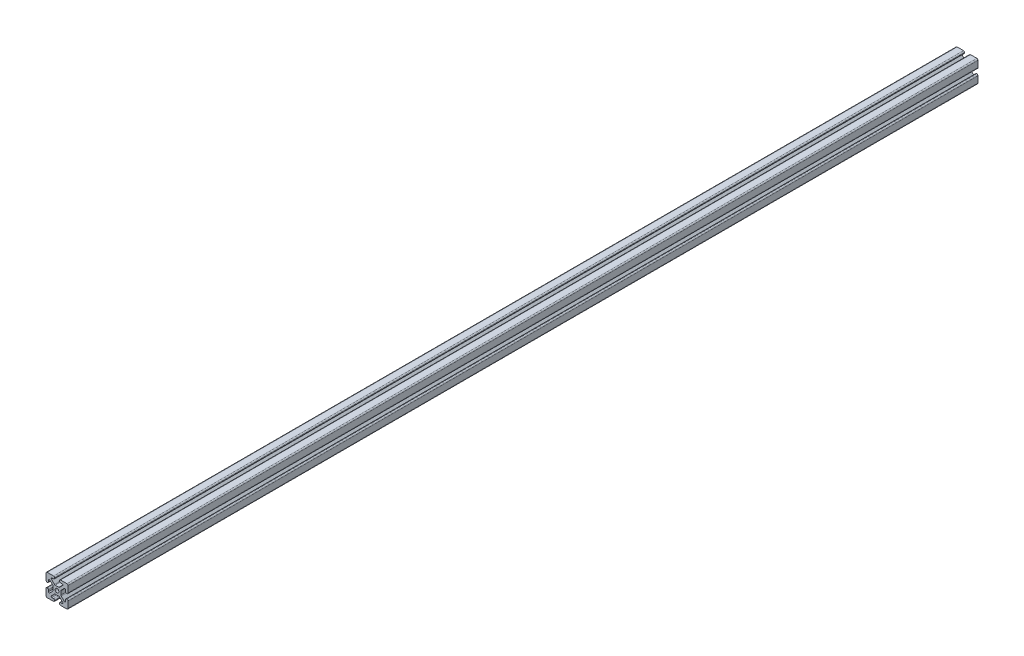
from build123d import *

# Parameters (mm, degrees)
SKETCH1_R           = 3.3274
BOSS_EXTRUDE1_DEPTH = 1574.8
FILLET2_R           = 2.032
FILLET3_R           = 2.032
FILLET4_R           = 1.27


with BuildPart() as part:
    # Sketch1 → Boss-Extrude1 (new body)
    with BuildSketch(Plane.XY):
        Polygon((6.7437, 3.870018041), (14.7447, 11.871018041), (14.7447, 4.064), (19.05, 4.064), (19.05, 19.05), (4.064, 19.05), (4.064, 14.7447), (11.871018041, 14.7447), (3.870018041, 6.7437), (-3.870018041, 6.7437), (-11.871018041, 14.7447), (-4.064, 14.7447), (-4.064, 19.05), (-19.05, 19.05), (-19.05, 4.064), (-14.7447, 4.064), (-14.7447, 11.871018041), (-6.7437, 3.870018041), (-6.7437, -3.870018041), (-14.7447, -11.871018041), (-14.7447, -4.064), (-19.05, -4.064), (-19.05, -19.05), (-4.064, -19.05), (-4.064, -14.7447), (-11.871018041, -14.7447), (-3.870018041, -6.7437), (3.870018041, -6.7437), (11.871018041, -14.7447), (4.064, -14.7447), (4.064, -19.05), (19.05, -19.05), (19.05, -4.064), (14.7447, -4.064), (14.7447, -11.871018041), (6.7437, -3.870018041), align=None)
        Circle(SKETCH1_R, mode=Mode.SUBTRACT)
    extrude(amount=BOSS_EXTRUDE1_DEPTH)

    # Fillet2
    fillet2_edges = [part.edges().sort_by_distance(p)[0] for p in [
        (-6.7437, -3.870018041, 787.4),
        (-6.7437, 3.870018041, 787.4),
        (-3.870018041, 6.7437, 787.4),
        (3.870018041, 6.7437, 787.4),
        (6.7437, 3.870018041, 787.4),
        (6.7437, -3.870018041, 787.4),
        (-3.870018041, -6.7437, 787.4),
        (3.870018041, -6.7437, 787.4),
    ]]
    fillet(fillet2_edges, radius=FILLET2_R)

    # Fillet3
    fillet3_edges = [part.edges().sort_by_distance(p)[0] for p in [
        (-19.05, -19.05, 787.4),
        (19.05, -19.05, 787.4),
        (19.05, 19.05, 787.4),
        (4.064, 14.7447, 787.4),
        (4.064, 19.05, 787.4),
        (-19.05, 19.05, 787.4),
        (-14.7447, -4.064, 787.4),
        (-19.05, -4.064, 787.4),
        (-19.05, 4.064, 787.4),
        (-14.7447, 4.064, 787.4),
        (-4.064, 14.7447, 787.4),
        (-4.064, 19.05, 787.4),
        (19.05, 4.064, 787.4),
        (14.7447, 4.064, 787.4),
        (-4.064, -19.05, 787.4),
        (-4.064, -14.7447, 787.4),
        (4.064, -19.05, 787.4),
        (4.064, -14.7447, 787.4),
        (14.7447, -4.064, 787.4),
        (19.05, -4.064, 787.4),
    ]]
    fillet(fillet3_edges, radius=FILLET3_R)

    # Fillet4
    fillet4_edges = [part.edges().sort_by_distance(p)[0] for p in [
        (-14.7447, 11.871018041, 787.4),
        (-11.871018041, 14.7447, 787.4),
        (11.871018041, 14.7447, 787.4),
        (14.7447, 11.871018041, 787.4),
        (14.7447, -11.871018041, 787.4),
        (11.871018041, -14.7447, 787.4),
        (-11.871018041, -14.7447, 787.4),
        (-14.7447, -11.871018041, 787.4),
    ]]
    fillet(fillet4_edges, radius=FILLET4_R)


solid = part.part
